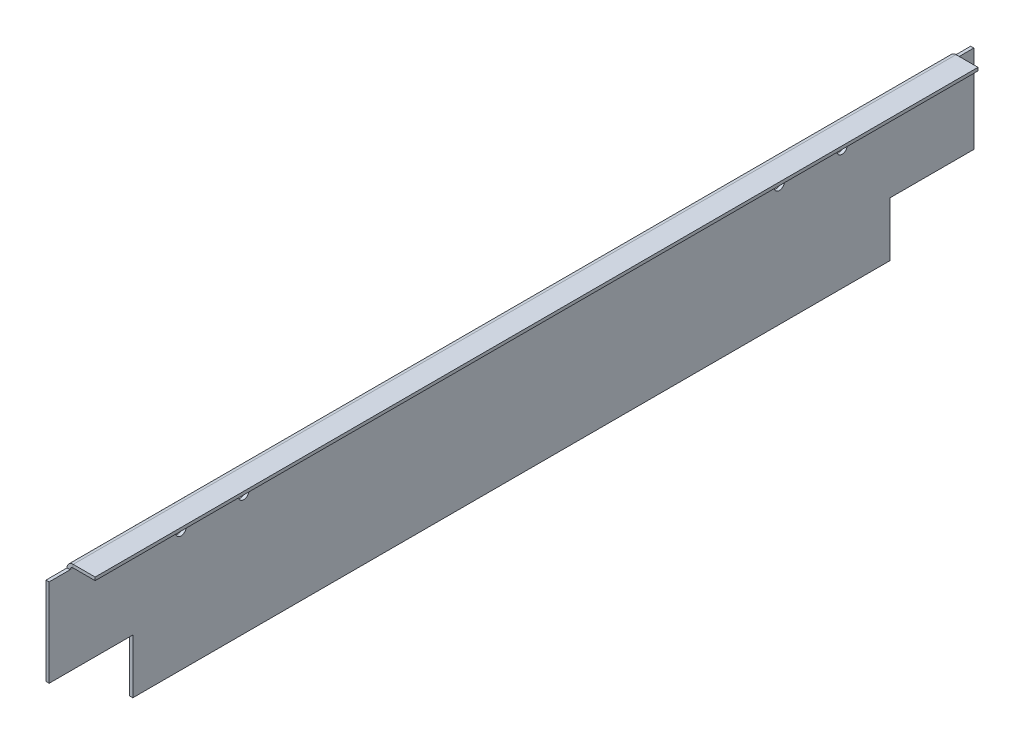
from build123d import *

# Parameters (mm, degrees)
SKETCH_1_W               = 362
SKETCH_1_H               = 68
SM_BASE_FLANGE_1_DEPTH   = 1.5
SKETCH_6_R               = 2.5
CUT_EXTRUDE_1_DEPTH      = 10
SKETCH_7_W               = 40
SKETCH_7_H               = 42
SM_BASE_FLANGE_1_2_DEPTH = 1.5
SM_EDGE_FLANGE_1_DEPTH   = 422


# Sheet-metal steps are written as plain solids
with BuildPart() as part:
    # Sketch 1 → Sm Base Flange 1 (new body)
    with BuildSketch(Plane(origin=(0, 0, 0), x_dir=(0, 0, -1), z_dir=(1, 0, 0))):
        with Locations((0, -34)):
            Rectangle(SKETCH_1_W, SKETCH_1_H)
    extrude(amount=-SM_BASE_FLANGE_1_DEPTH)

    # Эскиз6 → Вырез-Вытянуть1 (cut)
    with BuildSketch(Plane(origin=(0, 0, 0), x_dir=(0, 0, -1), z_dir=(1, 0, 0))):
        with Locations((158, -10)):
            Circle(SKETCH_6_R)
        with Locations((128, -10)):
            Circle(SKETCH_6_R)
        with Locations(Location((-128, -10, 0), (0, 0, 180))):
            Circle(SKETCH_6_R)
        with Locations(Location((-158, -10, 0), (0, 0, 180))):
            Circle(SKETCH_6_R)
    extrude(amount=-CUT_EXTRUDE_1_DEPTH, mode=Mode.SUBTRACT)

    # Эскиз7 → Sm Base Flange 1 2 (add)
    with BuildSketch(Plane(origin=(0, 0, 0), x_dir=(0, 0, -1), z_dir=(1, 0, 0))):
        with Locations((-201, -21)):
            Rectangle(SKETCH_7_W, SKETCH_7_H)
        with Locations((201, -21)):
            Rectangle(SKETCH_7_W, SKETCH_7_H)
    extrude(amount=-SM_BASE_FLANGE_1_2_DEPTH)

    # Ребро-кромка1 section (across the edge) → Ребро-кромка1 (add)
    with BuildSketch(Plane(origin=(0, 1.5, -211), x_dir=(0, -1, 0), z_dir=(0, 0, 1))):
        with BuildLine():
            Line((-1.5, 1.5), (-1.5, 12))
            Line((-1.5, 12), (0, 12))
            Line((0, 12), (0, 1.5))
            ThreePointArc((0, 1.5), (0.439339828, 0.439339828), (1.5, 0))
            Line((1.5, 0), (1.5, -1.5))
            ThreePointArc((1.5, -1.5), (-0.621320344, -0.621320344), (-1.5, 1.5))
        make_face()
    extrude(amount=SM_EDGE_FLANGE_1_DEPTH)


solid = part.part
